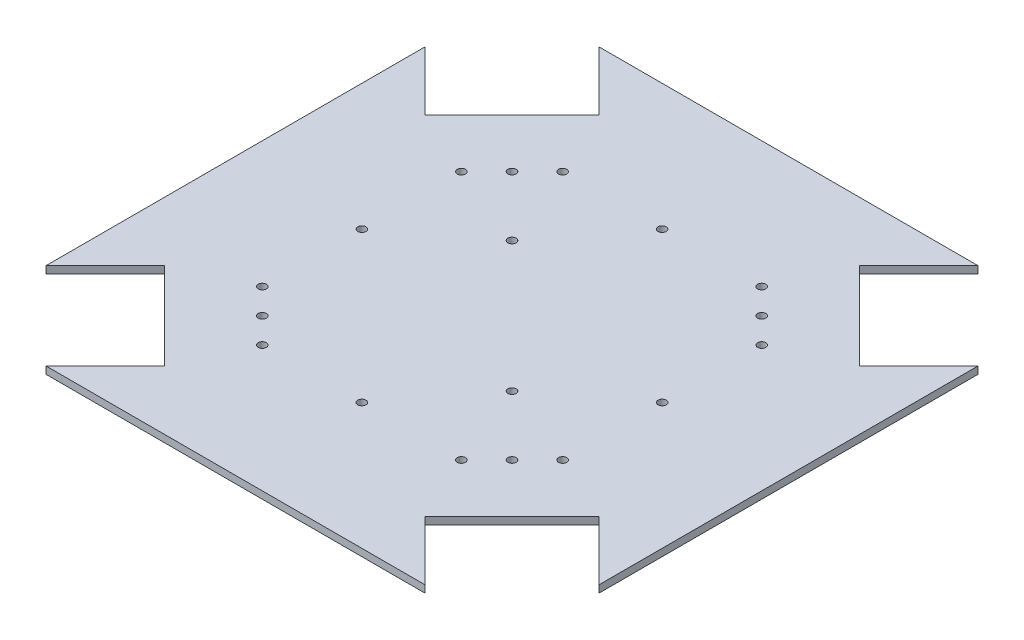
from build123d import *

# Parameters (mm, degrees)
SKETCH1_W                   = 228.6
SKETCH1_H                   = 228.6
PLATE_DEPTH                 = 3
SKETCH8_R                   = 1.7
MOTOR_MOUNT_HOLES_DEPTH     = 3
SKETCH9_R                   = 1.7
CONNECTOR_BOARD_HOLES_DEPTH = 3
SKETCH10_R                  = 1.7
LEVEL2_STANDOFF_HOLES_DEPTH = 3
WHEEL_SLOTS_DEPTH           = 3


with BuildPart() as part:
    # Sketch1 → plate (new body)
    with BuildSketch(Plane(origin=(0, 0, 0), x_dir=(1, 0, 0), z_dir=(0, 1, 0))):
        Rectangle(SKETCH1_W, SKETCH1_H)
    extrude(amount=PLATE_DEPTH)

    # Sketch8 → motor-mount-holes (cut)
    with BuildSketch(Plane(origin=(0, 3, 0), x_dir=(1, 0, 0), z_dir=(0, 1, 0))):
        with Locations((51.618795027, 51.618795027)):
            Circle(SKETCH8_R)
        with Locations((62.083975388, 41.153614665)):
            Circle(SKETCH8_R)
        with Locations((41.153614665, 62.083975388)):
            Circle(SKETCH8_R)
        with Locations((51.618795027, -51.618795027)):
            Circle(SKETCH8_R)
        with Locations((62.083975388, -41.153614665)):
            Circle(SKETCH8_R)
        with Locations((41.153614665, -62.083975388)):
            Circle(SKETCH8_R)
        with Locations((-51.618795027, -51.618795027)):
            Circle(SKETCH8_R)
        with Locations((-41.153614665, -62.083975388)):
            Circle(SKETCH8_R)
        with Locations((-62.083975388, -41.153614665)):
            Circle(SKETCH8_R)
        with Locations((-51.618795027, 51.618795027)):
            Circle(SKETCH8_R)
        with Locations((-62.083975388, 41.153614665)):
            Circle(SKETCH8_R)
        with Locations((-41.153614665, 62.083975388)):
            Circle(SKETCH8_R)
    extrude(amount=-MOTOR_MOUNT_HOLES_DEPTH, mode=Mode.SUBTRACT)

    # Sketch9 → connector-board-holes (cut)
    with BuildSketch(Plane(origin=(0, 3, 0), x_dir=(1, 0, 0), z_dir=(0, 1, 0))):
        with Locations((-26.961981567, 26.961981567)):
            Circle(SKETCH9_R)
        with Locations((26.961981567, -26.961981567)):
            Circle(SKETCH9_R)
    extrude(amount=-CONNECTOR_BOARD_HOLES_DEPTH, mode=Mode.SUBTRACT)

    # Sketch10 → level2-standoff-holes (cut)
    with BuildSketch(Plane(origin=(0, 3, 0), x_dir=(1, 0, 0), z_dir=(0, 1, 0))):
        with Locations((0, 62.08)):
            Circle(SKETCH10_R)
        with Locations((62.08, 0)):
            Circle(SKETCH10_R)
        with Locations((0, -62.08)):
            Circle(SKETCH10_R)
        with Locations((-62.08, 0)):
            Circle(SKETCH10_R)
    extrude(amount=-LEVEL2_STANDOFF_HOLES_DEPTH, mode=Mode.SUBTRACT)

    # Sketch2 → wheel-slots (cut)
    with BuildSketch(Plane(origin=(0, 3, 0), x_dir=(1, 0, 0), z_dir=(0, 1, 0))):
        Polygon((114.3, 114.3), (78.378975516, 114.3), (53.881536726, 89.802561211), (89.802561211, 53.881536726), (114.3, 78.378975516), align=None)
        Polygon((78.378975516, -114.3), (114.3, -114.3), (114.3, -78.378975516), (89.802561211, -53.881536726), (53.881536726, -89.802561211), align=None)
        Polygon((-114.3, -78.378975516), (-114.3, -114.3), (-78.378975516, -114.3), (-53.881536726, -89.802561211), (-89.802561211, -53.881536726), align=None)
        Polygon((-78.378975516, 114.3), (-114.3, 114.3), (-114.3, 78.378975516), (-89.802561211, 53.881536726), (-53.881536726, 89.802561211), align=None)
    extrude(amount=-WHEEL_SLOTS_DEPTH, mode=Mode.SUBTRACT)


solid = part.part
